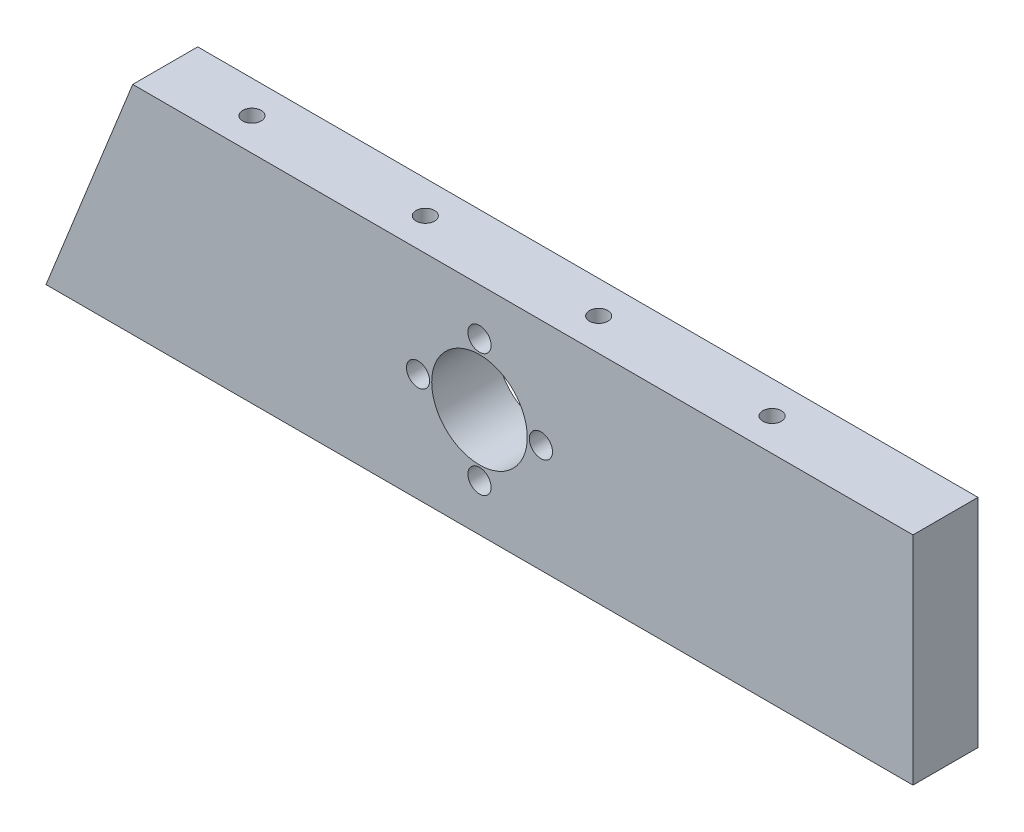
from build123d import *

# Parameters (mm, degrees)
SKETCH1_R           = 1.7
SKETCH1_R_2         = 7
BOSS_EXTRUDE1_DEPTH = 9.525
LPATTERN1_COUNT     = 4
LPATTERN1_PITCH     = 25.4


with BuildPart() as part:
    # Sketch1 → Boss-Extrude1 (new body)
    with BuildSketch(Plane.XY):
        Polygon((-50.8, 15.875), (63.5, 15.875), (63.5, -15.875), (-63.5, -15.875), align=None)
        with Locations((0, -9)):
            Circle(SKETCH1_R, mode=Mode.SUBTRACT)
        with Locations((-9, 0)):
            Circle(SKETCH1_R, mode=Mode.SUBTRACT)
        with Locations((0, 9)):
            Circle(SKETCH1_R, mode=Mode.SUBTRACT)
        with Locations((9, 0)):
            Circle(SKETCH1_R, mode=Mode.SUBTRACT)
        Circle(SKETCH1_R_2, mode=Mode.SUBTRACT)
    extrude(amount=BOSS_EXTRUDE1_DEPTH)

    # Sketch12 → Tap Drill for #6-32 Tap1 (revolve, cut)
    with BuildSketch(Plane(origin=(38.1, -15.875, 4.7625), x_dir=(0, 0, -1), z_dir=(1, 0, 0))):
        Polygon((0, 0), (0, 13.51269403), (1.35255, 12.7), (1.35255, 0), align=None)
    tap_drill_for_6_32_tap1 = revolve(axis=Axis((38.1, -22.225, 4.7625), (0, 1, 0)), mode=Mode.SUBTRACT)

    # LPattern1: Tap Drill for #6-32 Tap1 ×4
    with Locations(*[(-i * LPATTERN1_PITCH, 0, 0) for i in range(1, LPATTERN1_COUNT)]):
        add(tap_drill_for_6_32_tap1, mode=Mode.SUBTRACT)

    # Mirror8: Tap Drill for #6-32 Tap1 across plane
    add(tap_drill_for_6_32_tap1.mirror(Plane.ZX), mode=Mode.SUBTRACT)

    # Mirror8 copy 1 sketch → Mirror8 copy 1 (revolve, cut)
    with BuildSketch(Plane(origin=(12.7, 15.875, 4.7625), x_dir=(0, 0, -1), z_dir=(1, 0, 0))):
        Polygon((0, 0), (0, -13.51269403), (1.35255, -12.7), (1.35255, 0), align=None)
    revolve(axis=Axis((12.7, 22.225, 4.7625), (0, 1, 0)), mode=Mode.SUBTRACT)

    # Mirror8 copy 2 sketch → Mirror8 copy 2 (revolve, cut)
    with BuildSketch(Plane(origin=(-12.7, 15.875, 4.7625), x_dir=(0, 0, -1), z_dir=(1, 0, 0))):
        Polygon((0, 0), (0, -13.51269403), (1.35255, -12.7), (1.35255, 0), align=None)
    revolve(axis=Axis((-12.7, 22.225, 4.7625), (0, 1, 0)), mode=Mode.SUBTRACT)

    # Mirror8 copy 3 sketch → Mirror8 copy 3 (revolve, cut)
    with BuildSketch(Plane(origin=(-38.1, 15.875, 4.7625), x_dir=(0, 0, -1), z_dir=(1, 0, 0))):
        Polygon((0, 0), (0, -13.51269403), (1.35255, -12.7), (1.35255, 0), align=None)
    revolve(axis=Axis((-38.1, 22.225, 4.7625), (0, 1, 0)), mode=Mode.SUBTRACT)


solid = part.part
